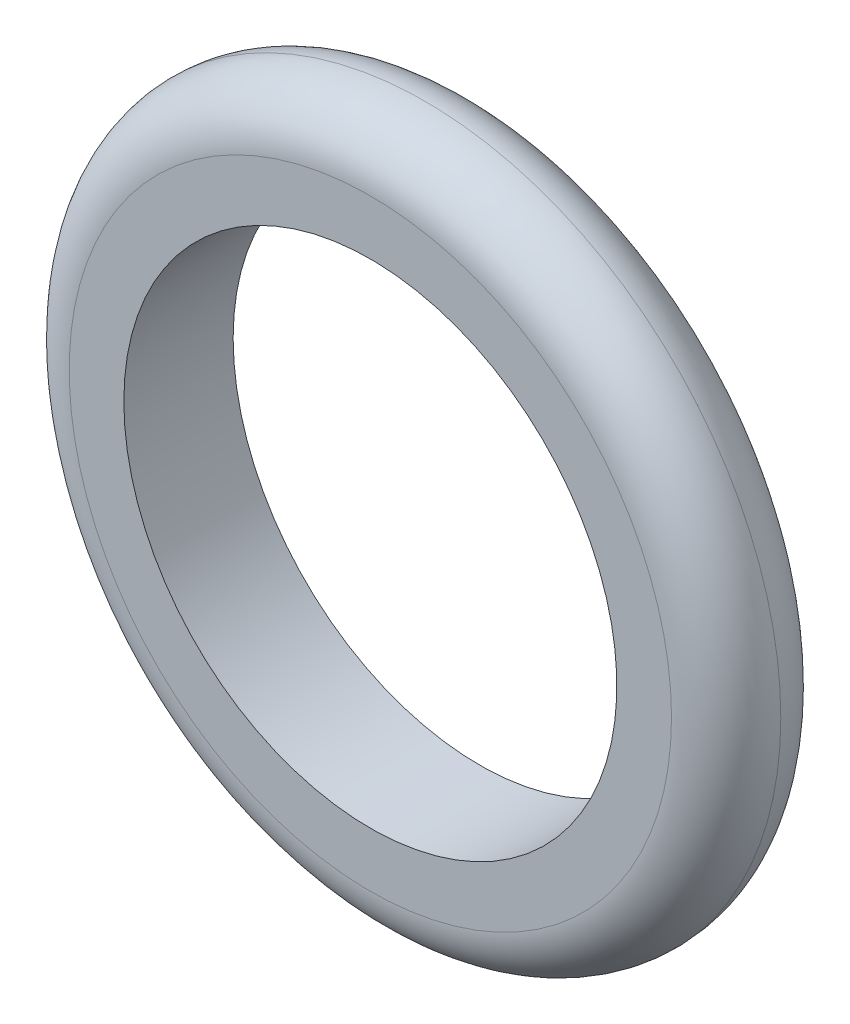
from build123d import *

# Parameters (mm, degrees)
SZKIC1_R                    = 293
SZKIC1_R_2                  = 203
DODANIE_WYCI_GNI_CIE1_DEPTH = 90
ZAOKR_GLENIE1_R             = 45


with BuildPart() as part:
    # Szkic1 → Dodanie-wyciągnięcie1 (new body)
    with BuildSketch(Plane.XY):
        with Locations(Location((0, 0, 0), (0, 0, 180))):
            Circle(SZKIC1_R)
        with Locations(Location((0, 0, 0), (0, 0, 180))):
            Circle(SZKIC1_R_2, mode=Mode.SUBTRACT)
    extrude(amount=DODANIE_WYCI_GNI_CIE1_DEPTH)

    # Zaokrąglenie1
    zaokr_glenie1_edges = [part.edges().sort_by_distance(p)[0] for p in [
        (293, 0, 0),
        (293, 0, 90),
    ]]
    fillet(zaokr_glenie1_edges, radius=ZAOKR_GLENIE1_R - 0.0001)  # a hair under: the kernel refuses the full size


solid = part.part
